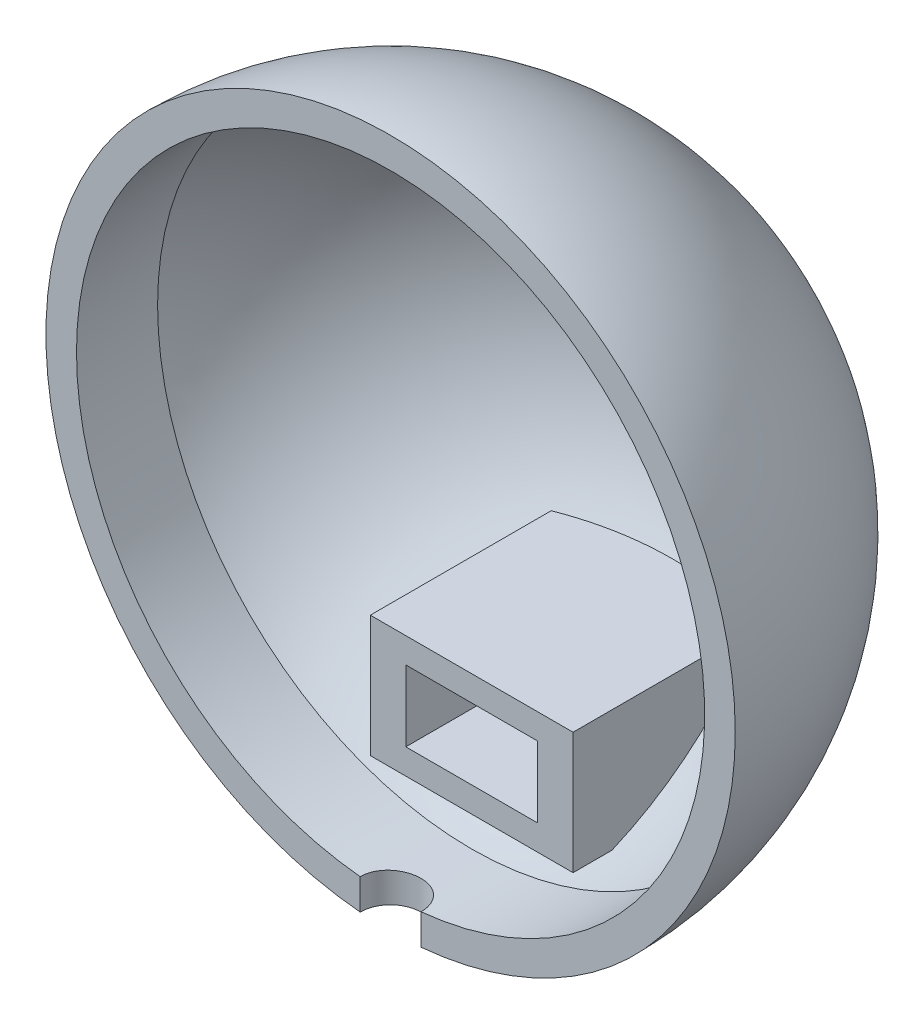
from build123d import *

# Parameters (mm, degrees)
CUT_EXTRUDE_START    = -17
CUT_EXTRUDE_1_DEPTH  = 1.580856159
EXTRUDE_1_REACH      = 29.331
EXTRUDE_1_END_RADIUS = 16
SKETCH_3_W           = 10
SKETCH_3_H           = 6
SKETCH_3_W_2         = 6.5
SKETCH_3_H_2         = 3.5
SKETCH_4_R           = 0.5


# Read off the part's stored shape, not the designer's step: 切除-拉伸1
with BuildPart() as part:
    # 草图1 → 旋转1 (revolve)
    with BuildSketch(Plane(origin=(0, 0, 0), x_dir=(1, 0, 0), z_dir=(0, 1, 0))):
        with BuildLine():
            Line((15.491933385, 4), (15.491933385, 0))
            Line((15.491933385, 0), (17, 0))
            ThreePointArc((17, 0), (12.02081528, 12.02081528), (0, 17))
            Line((0, 17), (0, 16))
            ThreePointArc((0, 16), (9.797958971, 12.649110641), (15.491933385, 4))
        make_face()
    revolve(axis=Axis((0, 0, -17), (0, 0, 1)))

    # 切除-拉伸1 outline → 切除-拉伸1 (cut)
    with BuildSketch(Plane(origin=(0, 0, 0), x_dir=(1, 0, 0), z_dir=(0, 1, 0)).offset(CUT_EXTRUDE_START)):
        with BuildLine():
            Line((-1.5, 0), (1.5, 0))
            ThreePointArc((1.5, 0), (0, 1.5), (-1.5, 0))
        make_face()
    extrude(amount=CUT_EXTRUDE_1_DEPTH, mode=Mode.SUBTRACT)

    # 凸台-拉伸1: up to this sphere (the profile starts inside it)
    extrude_1_end = Location((0, 0, 0)) * Sphere(EXTRUDE_1_END_RADIUS, mode=Mode.PRIVATE)
    # 草图3 → 凸台-拉伸1 (add, up to the surface)
    with BuildSketch(Plane.XY.offset(-4), mode=Mode.PRIVATE) as extrude_1_sk1:
        with Locations((0, -11)):
            Rectangle(SKETCH_3_W, SKETCH_3_H)
        with Locations((0, -11)):
            Rectangle(SKETCH_3_W_2, SKETCH_3_H_2, mode=Mode.SUBTRACT)
    extrude_1_tool1 = extrude(extrude_1_sk1.sketch, amount=-EXTRUDE_1_REACH, mode=Mode.PRIVATE) & extrude_1_end
    add(extrude_1_tool1.solids().sort_by_distance((0, -8.116619, -4))[0])

    # 草图4 → 切除-旋转1 (revolve, cut)
    with BuildSketch(Plane(origin=(0, 0, 0), x_dir=(1, 0, 0), z_dir=(0, 1, 0))):
        with Locations((9, 14.422205102)):
            Circle(SKETCH_4_R)
    revolve(axis=Axis((0, 0, 0), (0, 0, -1)), mode=Mode.SUBTRACT)


solid = part.part
